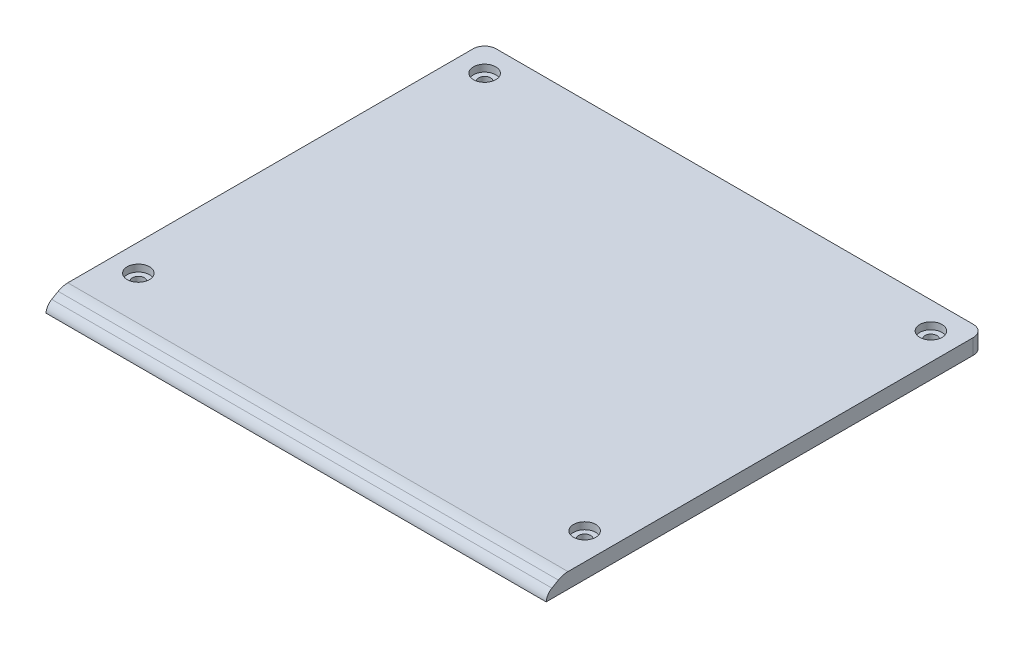
from build123d import *

# Parameters (mm, degrees)
SKETCH_1_W                  = 130
SKETCH_1_H                  = 114
EXTRUDE_1_DEPTH             = 4
CHAMFER_1_SIZE              = 2.5
CHAMFER_1_SIZE2             = 4.330127019
FILLET_1_R                  = 5
FILLET_2_R                  = 3
FILLET_3_R                  = 3
SKETCH_2_R                  = 1.55
CUT_EXTRUDE_1_DEPTH         = 87.544786094
PATTERN_LINEAR_1_COUNT      = 2
PATTERN_LINEAR_1_PITCH      = 116
PATTERN_LINEAR_1_COUNT_DIR2 = 2
PATTERN_LINEAR_1_PITCH_DIR2 = 90
SKETCH_4_R                  = 2.9
CUT_EXTRUDE_2_DEPTH         = 1.8
PATTERN_LINEAR_2_COUNT      = 2
PATTERN_LINEAR_2_PITCH      = 116
PATTERN_LINEAR_2_COUNT_DIR2 = 2
PATTERN_LINEAR_2_PITCH_DIR2 = 90


with BuildPart() as part:
    # Эскиз1 → Бобышка-Вытянуть1 (new body)
    with BuildSketch(Plane(origin=(0, 0, 0), x_dir=(1, 0, 0), z_dir=(0, 1, 0))):
        Rectangle(SKETCH_1_W, SKETCH_1_H)
    extrude(amount=EXTRUDE_1_DEPTH)

    # Фаска1
    chamfer_1_edges = [part.edges().sort_by_distance(p)[0] for p in [
        (0, 4, 57),
    ]]
    chamfer_1_side = [part.faces().sort_by_distance(p)[0] for p in [
        (0, 2, 57),
    ]]
    chamfer(chamfer_1_edges, length=CHAMFER_1_SIZE, length2=CHAMFER_1_SIZE2, reference=chamfer_1_side[0])

    # Скругление1
    fillet_1_edges = [part.edges().sort_by_distance(p)[0] for p in [
        (0, 4, 52.669872981),
    ]]
    fillet(fillet_1_edges, radius=FILLET_1_R)

    # Скругление2
    # the kernel refuses this fillet: 3 mm, written as the material it takes off along each edge
    with BuildSketch(Plane(origin=(69.302949009, 1.5, 57), x_dir=(0, 0.4999999999999978, -0.8660254037844398), z_dir=(-1, 0, 0))) as fillet_2_piece_1:
        with BuildLine():
            CenterArc((1.721179604, 3), FILLET_2_R, 214.540406951, 55.459593049)
            Line((-0.75, 1.299038106), (-0.799423592, 1.265018868))
            ThreePointArc((-0.799423592, 1.265018868), (-0.426961524, 0.619519053), (-0.051961524, -0.03))
            Line((-0.051961524, -0.03), (0, -0.06))
            Line((0, -0.06), (1.721179604, -0.06))
            Line((1.721179604, -0.06), (1.721179604, 0))
        make_face()
    extrude(amount=138.605898019, mode=Mode.SUBTRACT)

    # Скругление3
    fillet_3_edges = [part.edges().sort_by_distance(p)[0] for p in [
        (-65, 2, -57),
        (65, 2, -57),
    ]]
    fillet(fillet_3_edges, radius=FILLET_3_R)

    # Эскиз2 → Вырез-Вытянуть1 (cut, through all)
    with BuildSketch(Plane(origin=(0, 4, 0), x_dir=(1, 0, 0), z_dir=(0, 1, 0))):
        with Locations(Location((-58, 50, 0), (0, 0, 270))):
            Circle(SKETCH_2_R)
    cut_extrude_1 = extrude(amount=-CUT_EXTRUDE_1_DEPTH, mode=Mode.SUBTRACT)

    # Линейный массив1: Cut-Extrude 1 2 × 2
    with Locations(*[(i * PATTERN_LINEAR_1_PITCH, 0, j * PATTERN_LINEAR_1_PITCH_DIR2) for i in range(PATTERN_LINEAR_1_COUNT) for j in range(PATTERN_LINEAR_1_COUNT_DIR2) if (i, j) != (0, 0)]):
        add(cut_extrude_1, mode=Mode.SUBTRACT)

    # Эскиз4 → Вырез-Вытянуть2 (cut)
    with BuildSketch(Plane(origin=(0, 4, 0), x_dir=(1, 0, 0), z_dir=(0, 1, 0))):
        with Locations(Location((-58, 50, 0), (0, 0, 270))):
            Circle(SKETCH_4_R)
    cut_extrude_2 = extrude(amount=-CUT_EXTRUDE_2_DEPTH, mode=Mode.SUBTRACT)

    # Линейный массив2: Cut-Extrude 2 2 × 2
    with Locations(*[(i * PATTERN_LINEAR_2_PITCH, 0, j * PATTERN_LINEAR_2_PITCH_DIR2) for i in range(PATTERN_LINEAR_2_COUNT) for j in range(PATTERN_LINEAR_2_COUNT_DIR2) if (i, j) != (0, 0)]):
        add(cut_extrude_2, mode=Mode.SUBTRACT)


solid = part.part
